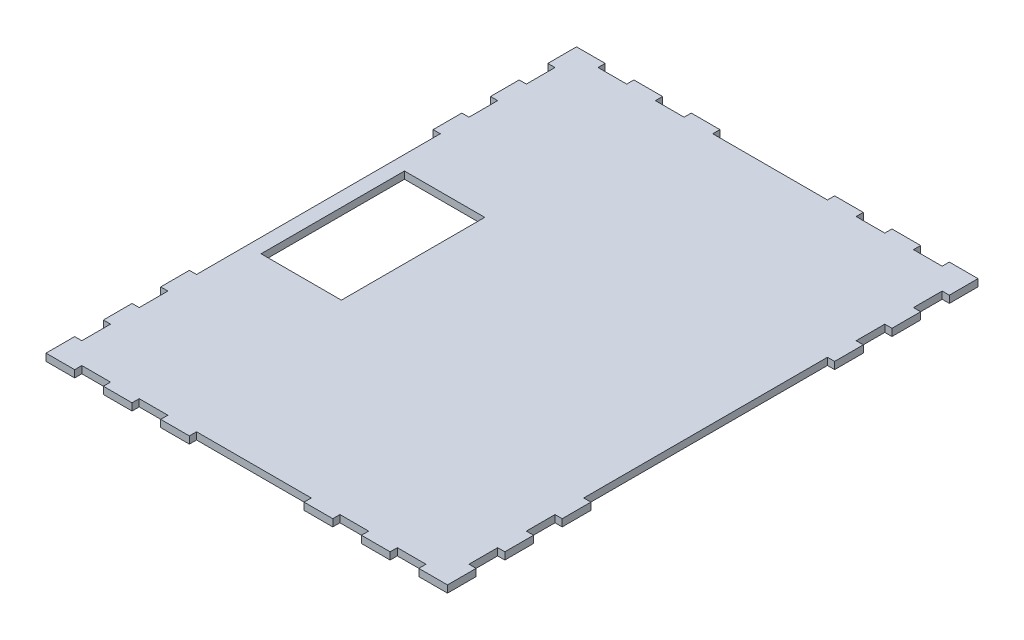
from build123d import *

# Parameters (mm, degrees)
BOSS_EXTRUDE1_DEPTH = 3.175
SKETCH5_W           = 50.8
SKETCH5_H           = 3.175
SKETCH5_W_2         = 12.7
CUT_EXTRUDE4_DEPTH  = 7.62
SKETCH7_W           = 35.56
SKETCH7_H           = 63.5
CUT_EXTRUDE5_DEPTH  = 7.62


with BuildPart() as part:
    # Sketch1 → Boss-Extrude1 (new body)
    with BuildSketch(Plane(origin=(0, 0, 0), x_dir=(1, 0, 0), z_dir=(0, 1, 0))):
        Polygon((3.175, 209.55), (0, 209.55), (0, 196.85), (3.175, 196.85), (3.175, 184.15), (0, 184.15), (0, 171.45), (3.175, 171.45), (3.175, 63.5), (0, 63.5), (0, 50.8), (3.175, 50.8), (3.175, 38.1), (0, 38.1), (0, 25.4), (3.175, 25.4), (3.175, 12.7), (0, 12.7), (0, 0), (177.8, 0), (177.8, 12.7), (174.625, 12.7), (174.625, 25.4), (177.8, 25.4), (177.8, 38.1), (174.625, 38.1), (174.625, 50.8), (177.8, 50.8), (177.8, 63.5), (174.625, 63.5), (174.625, 171.45), (177.8, 171.45), (177.8, 184.15), (174.625, 184.15), (174.625, 196.85), (177.8, 196.85), (177.8, 209.55), (174.625, 209.55), (174.625, 222.25), (177.8, 222.25), (177.8, 234.95), (0, 234.95), (0, 222.25), (3.175, 222.25), align=None)
    extrude(amount=BOSS_EXTRUDE1_DEPTH)

    # Sketch5 → Cut-Extrude4 (cut)
    with BuildSketch(Plane(origin=(0, 3.175, 0), x_dir=(1, 0, 0), z_dir=(0, 1, 0))):
        with Locations((88.9, 1.5875)):
            Rectangle(SKETCH5_W, SKETCH5_H)
        with Locations((44.45, 1.5875)):
            Rectangle(SKETCH5_W_2, SKETCH5_H)
        with Locations((133.35, 1.5875)):
            Rectangle(SKETCH5_W_2, SKETCH5_H)
        with Locations((19.05, 1.5875)):
            Rectangle(SKETCH5_W_2, SKETCH5_H)
        with Locations((158.75, 1.5875)):
            Rectangle(SKETCH5_W_2, SKETCH5_H)
    cut_extrude4 = extrude(amount=-CUT_EXTRUDE4_DEPTH, mode=Mode.SUBTRACT)

    # Mirror1: Cut-Extrude4 across plane
    add(cut_extrude4.mirror(Plane.XY.offset(-117.475)), mode=Mode.SUBTRACT)

    # Sketch7 → Cut-Extrude5 (cut)
    with BuildSketch(Plane(origin=(0, 3.175, 0), x_dir=(1, 0, 0), z_dir=(0, 1, 0))):
        with Locations((27.305, 117.475)):
            Rectangle(SKETCH7_W, SKETCH7_H)
    extrude(amount=-CUT_EXTRUDE5_DEPTH, mode=Mode.SUBTRACT)


solid = part.part
